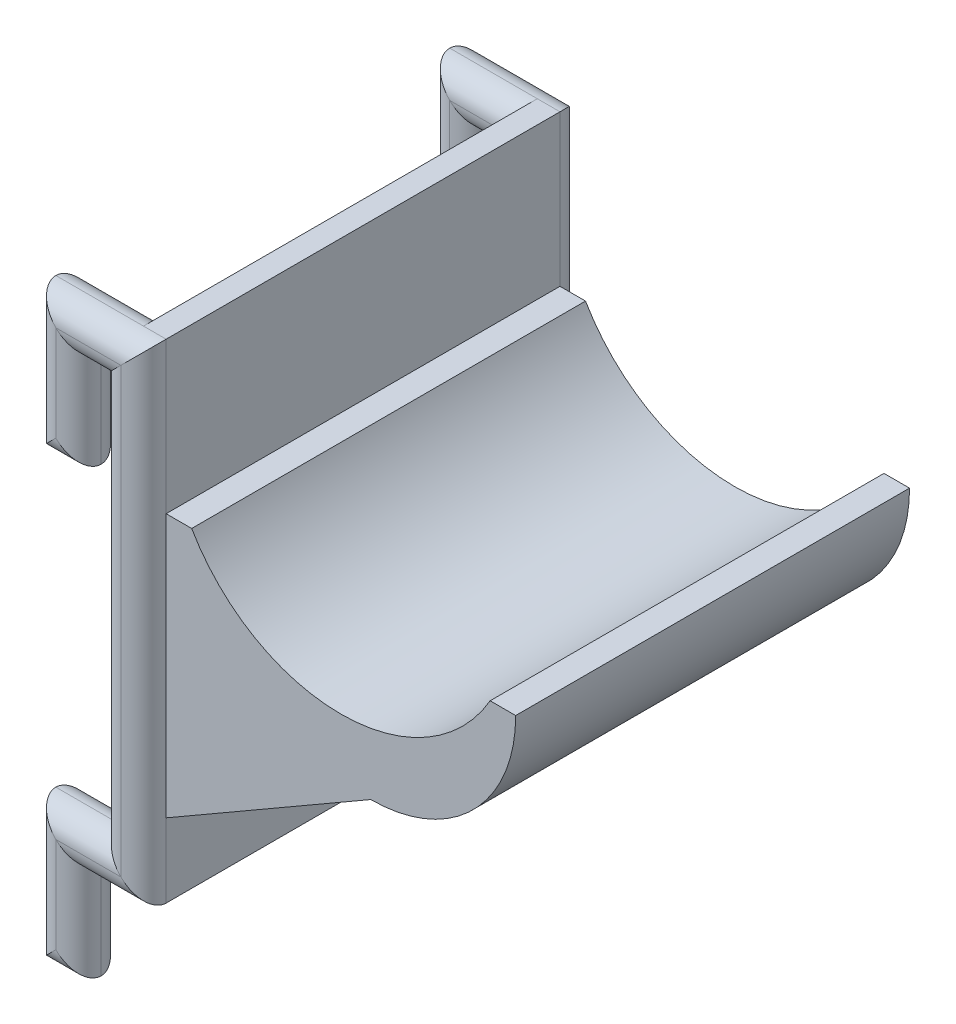
from build123d import *

# Parameters (mm, degrees)
EXTRU_MINCE1_DEPTH         = 2.3
CONG_1_R                   = 2.3
ESQUISSE2_W                = 40
ESQUISSE2_H                = 49.6
BOSS_EXTRU_1_DEPTH         = 2.3
R_P_TITION_LIN_AIRE1_COUNT = 2
R_P_TITION_LIN_AIRE1_PITCH = 40
CONG_2_R                   = 2.3
BOSS_EXTRU_2_DEPTH         = 40
ENL_V_START                = 37.8
ESQUISSE4_W                = 30
ESQUISSE4_H                = 12
ENL_V_MAT_EXTRU_1_DEPTH    = 35.5


with BuildPart() as part:
    # Esquisse1 → Extru.-Mince1 (new, symmetric)
    with BuildSketch(Plane.XY):
        Polygon((-4.3, -57), (-4.3, -47.3), (2.3, -47.3), (2.3, 2.3), (-8.9, 2.3), (-8.9, -12), (-4.3, -12), (-4.3, -2.3), (-2.3, -2.3), (-2.3, -42.7), (-8.9, -42.7), (-8.9, -57), align=None)
    extru_mince1 = extrude(amount=EXTRU_MINCE1_DEPTH, both=True)

    # Congé1
    cong_1_edges = [part.edges().sort_by_distance(p)[0] for p in [
        (-6.6, -57, -2.3),
        (-4.3, -52.15, -2.3),
        (-1, -47.3, -2.3),
        (2.3, -22.5, -2.3),
        (-3.3, 2.3, -2.3),
        (-8.9, -4.85, -2.3),
        (-6.6, -12, -2.3),
        (-4.3, -7.15, -2.3),
        (-3.3, -2.3, -2.3),
        (-2.3, -22.5, -2.3),
        (-5.6, -42.7, -2.3),
        (-8.9, -49.85, -2.3),
        (-5.6, -42.7, 2.3),
        (-2.3, -22.5, 2.3),
        (-3.3, -2.3, 2.3),
        (-4.3, -7.15, 2.3),
        (-6.6, -12, 2.3),
        (-8.9, -4.85, 2.3),
        (-3.3, 2.3, 2.3),
        (2.3, -22.5, 2.3),
        (-1, -47.3, 2.3),
        (-4.3, -52.15, 2.3),
        (-6.6, -57, 2.3),
        (-8.9, -49.85, 2.3),
    ]]
    fillet(cong_1_edges, radius=CONG_1_R - 0.0001)  # a hair under: the kernel refuses the full size

    # Esquisse2 → Boss.-Extru.1 (add)
    with BuildSketch(Plane(origin=(0, 0, 0), x_dir=(0, 0, -1), z_dir=(1, 0, 0))):
        with Locations((-20, -22.5)):
            Rectangle(ESQUISSE2_W, ESQUISSE2_H)
    extrude(amount=BOSS_EXTRU_1_DEPTH)

    # Répétition linéaire1: Extru.-Mince1 ×2
    with Locations(*[(0, 0, i * R_P_TITION_LIN_AIRE1_PITCH) for i in range(1, R_P_TITION_LIN_AIRE1_COUNT)]):
        add(extru_mince1)

    # Congé2
    cong_2_edges = [part.edges().sort_by_distance(p)[0] for p in [
        (-5.6, -42.7, 42.3),
        (-2.3, -22.5, 42.3),
        (-3.3, -2.3, 42.3),
        (-4.3, -7.15, 42.3),
        (-6.6, -12, 42.3),
        (-8.9, -4.85, 42.3),
        (-3.3, 2.3, 42.3),
        (2.3, -22.5, 42.3),
        (-6.6, -57, 42.3),
        (-4.3, -52.15, 42.3),
        (-1, -47.3, 42.3),
        (-8.9, -49.85, 42.3),
        (-2.15, -47.3, 37.7),
        (-4.3, -52.15, 37.7),
        (-6.6, -57, 37.7),
        (-8.9, -49.85, 37.7),
        (-5.6, -42.7, 37.7),
        (-2.3, -22.5, 37.7),
        (-3.3, -2.3, 37.7),
        (-4.3, -7.15, 37.7),
        (-6.6, -12, 37.7),
        (-8.9, -4.85, 37.7),
        (-4.45, 2.3, 37.7),
    ]]
    fillet(cong_2_edges, radius=CONG_2_R - 0.0001)  # a hair under: the kernel refuses the full size

    # Esquisse3 → Boss.-Extru.2 (add)
    with BuildSketch(Plane.XY):
        with BuildLine():
            Line((2.3, -39.8), (2.3, -13.05))
            Line((2.3, -13.05), (4.894555434, -13.05))
            ThreePointArc((4.894555434, -13.05), (20.05, -21.8), (35.205444566, -13.05))
            Line((35.205444566, -13.05), (37.8, -13.05))
            ThreePointArc((37.8, -13.05), (33.502205526, -23.477720869), (23.084609691, -27.8))
            Line((23.084609691, -27.8), (2.3, -39.8))
        make_face()
    extrude(amount=BOSS_EXTRU_2_DEPTH)

    # Esquisse4 → Enlèv. mat.-Extru.1 (cut)
    with BuildSketch(Plane(origin=(0, 0, 0), x_dir=(0, 0, -1), z_dir=(1, 0, 0)).offset(ENL_V_START)):
        with Locations((-20, -33.8)):
            Rectangle(ESQUISSE4_W, ESQUISSE4_H)
    extrude(amount=-ENL_V_MAT_EXTRU_1_DEPTH, mode=Mode.SUBTRACT)


solid = part.part
